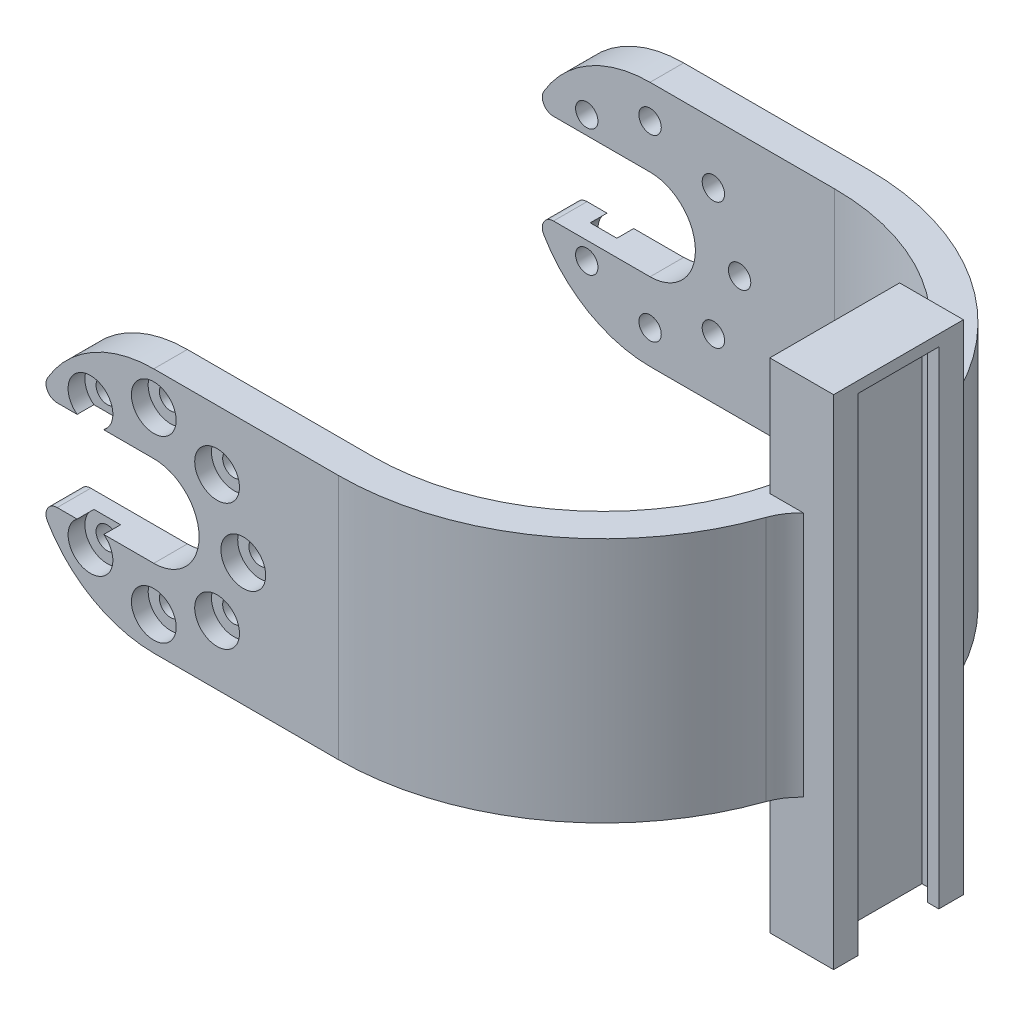
from build123d import *

# Parameters (mm, degrees)
SKETCH1_W                 = 120
SKETCH1_H                 = 22
EXTRUDE_THIN1_DEPTH       = 3
SKETCH2_R                 = 4.05
CUT_EXTRUDE1_DEPTH        = 123.036879672
FILLET2_R                 = 11
SKETCH5_R                 = 1
CUT_EXTRUDE3_DEPTH        = 123.036879672
CIRPATTERN1_COUNT         = 8
SKETCH10_R                = 2
CUT_EXTRUDE5_DEPTH        = 1.5
CIRPATTERN3_COUNT         = 8
SKETCH11_R                = 4.05
SKETCH11_R_2              = 1
BOSS_EXTRUDE1_DEPTH       = 3
CUT_EXTRUDE6_START        = -1.5
SKETCH12_R                = 2
CUT_EXTRUDE6_DEPTH        = 1.5
CIRPATTERN4_COUNT         = 8
SKETCH13_W                = 5
SKETCH13_H                = 22
BOSS_EXTRUDE2_DEPTH       = 41.35
CUT_EXTRUDE7_START        = -1
CUT_EXTRUDE7_DEPTH        = 12
FILLET4_R                 = 1
SKETCH20_W                = 10
SKETCH20_H                = 36
BOSS_EXTRUDE3_DEPTH       = 2
BOSS_EXTRUDE4_DEPTH       = 3
SKETCH24_W                = 10
SKETCH24_H                = 5.5
BOSS_EXTRUDE5_DEPTH       = 3
SKETCH25_W                = 10
SKETCH25_H                = 5.5
BOSS_EXTRUDE6_DEPTH       = 2.85
SKETCH22_R                = 1.35
CUT_EXTRUDE9_DEPTH        = 132.178971257
FILLET6_R                 = 2
FILLET7_R                 = 10
SKETCH29_W                = 10
SKETCH29_H                = 1.7
BOSS_EXTRUDE7_DEPTH       = 3
SKETCH30_W                = 10
SKETCH30_H                = 1.7
BOSS_EXTRUDE8_DEPTH       = 3
FILLET8_R                 = 3
FILLET9_R                 = 3
CUT_EXTRUDE10_REACH       = 134.223
SKETCH31_R                = 1.143
CUT_EXTRUDE11_DEPTH       = 10
CUT_EXTRUDE11_DEPTH_BACK  = 30
SKETCH32_W                = 86.5
SKETCH32_H                = 47.35
SKETCH38_W                = 6
SKETCH38_H                = 47.35
CUT_EXTRUDE19_DEPTH       = 35
BOSS_EXTRUDE11_DEPTH      = 22
BOSS_EXTRUDE12_DEPTH      = 21.5
BOSS_EXTRUDE12_DEPTH_BACK = 43.5
SKETCH39_W                = 3
SKETCH39_H                = 11.6
FILLET10_R                = 5
SKETCH40_W                = 1
SKETCH40_H                = 65
BOSS_EXTRUDE13_DEPTH      = 1.7
SKETCH42_W                = 2.2
SKETCH42_H                = 65
BOSS_EXTRUDE14_DEPTH      = 1
SKETCH43_W                = 1.7
SKETCH43_H                = 9.6
BOSS_EXTRUDE15_DEPTH      = 1.15
SKETCH44_W                = 1
SKETCH44_H                = 7.2
BOSS_EXTRUDE16_DEPTH      = 2.09
SKETCH46_W                = 11.6
SKETCH46_H                = 11
SKETCH46_H_2              = 9.5
CUT_EXTRUDE20_DEPTH       = 10
BOSS_EXTRUDE17_REACH      = 78.68
SKETCH48_W                = 11.6
SKETCH48_H                = 1


with BuildPart() as part:
    # Sketch1 → Extrude-Thin1 (new body)
    with BuildSketch(Plane.XY):
        with Locations((60, -11)):
            Rectangle(SKETCH1_W, SKETCH1_H)
    extrude(amount=EXTRUDE_THIN1_DEPTH)

    # Sketch2 → Cut-Extrude1 (cut, through all)
    with BuildSketch(Plane.XY.offset(3)):
        with Locations((11, -11)):
            Circle(SKETCH2_R)
    extrude(amount=-CUT_EXTRUDE1_DEPTH, mode=Mode.SUBTRACT)

    # Fillet2
    fillet2_edges = [part.edges().sort_by_distance(p)[0] for p in [
        (0, -22, 1.5),
        (0, 0, 1.5),
    ]]
    fillet(fillet2_edges, radius=FILLET2_R - 0.0001)  # a hair under: the kernel refuses the full size

    # Sketch5 → Cut-Extrude3 (cut, through all)
    with BuildSketch(Plane.XY.offset(3)):
        with Locations((11, -3)):
            Circle(SKETCH5_R)
    cut_extrude3 = extrude(amount=-CUT_EXTRUDE3_DEPTH, mode=Mode.SUBTRACT)

    # CirPattern1: Cut-Extrude3 ×8 about axis
    cirpattern1_axis = Axis((11, -11, 0), (0, 0, 1))
    for i in range(1, CIRPATTERN1_COUNT):
        add(cut_extrude3.rotate(cirpattern1_axis, i * 360 / CIRPATTERN1_COUNT), mode=Mode.SUBTRACT)

    # Sketch10 → Cut-Extrude5 (cut)
    with BuildSketch(Plane.XY.offset(3)):
        with Locations((11, -3)):
            Circle(SKETCH10_R)
    cut_extrude5 = extrude(amount=-CUT_EXTRUDE5_DEPTH, mode=Mode.SUBTRACT)

    # CirPattern3: Cut-Extrude5 ×8 about axis
    cirpattern3_axis = Axis((11, -11, 0), (0, 0, 1))
    for i in range(1, CIRPATTERN3_COUNT):
        add(cut_extrude5.rotate(cirpattern3_axis, i * 360 / CIRPATTERN3_COUNT), mode=Mode.SUBTRACT)



with BuildPart() as body_2:
    # Sketch11 → Boss-Extrude1 (new body)
    with BuildSketch(Plane.XY.offset(-41.35)):
        with BuildLine():
            Line((11, 0), (120, 0))
            Line((120, 0), (120, -22))
            Line((120, -22), (11, -22))
            ThreePointArc((11, -22), (3.221825407, -18.778174593), (0, -11))
            ThreePointArc((0, -11), (3.221825407, -3.221825407), (11, 0))
        make_face()
        with Locations((11, -11)):
            Circle(SKETCH11_R, mode=Mode.SUBTRACT)
        with Locations((11, -3)):
            Circle(SKETCH11_R_2, mode=Mode.SUBTRACT)
        with Locations(Location((5.343145751, -5.343145751, 0), (0, 0, 45))):
            Circle(SKETCH11_R_2, mode=Mode.SUBTRACT)
        with Locations(Location((3, -11, 0), (0, 0, 90))):
            Circle(SKETCH11_R_2, mode=Mode.SUBTRACT)
        with Locations(Location((5.343145751, -16.656854249, 0), (0, 0, 135))):
            Circle(SKETCH11_R_2, mode=Mode.SUBTRACT)
        with Locations(Location((11, -19, 0), (0, 0, 180))):
            Circle(SKETCH11_R_2, mode=Mode.SUBTRACT)
        with Locations(Location((16.656854249, -16.656854249, 0), (0, 0, 225))):
            Circle(SKETCH11_R_2, mode=Mode.SUBTRACT)
        with Locations(Location((16.656854249, -5.343145751, 0), (0, 0, 315))):
            Circle(SKETCH11_R_2, mode=Mode.SUBTRACT)
        with Locations(Location((19, -11, 0), (0, 0, 270))):
            Circle(SKETCH11_R_2, mode=Mode.SUBTRACT)
    extrude(amount=-BOSS_EXTRUDE1_DEPTH)

    # Sketch12 → Cut-Extrude6 (cut)
    with BuildSketch(Plane(origin=(0, 0, -44.35), x_dir=(-1, 0, 0), z_dir=(0, 0, -1)).offset(CUT_EXTRUDE6_START)):
        with Locations(Location((-11, -3, 0), (0, 0, 180))):
            Circle(SKETCH12_R)
    cut_extrude6 = extrude(amount=CUT_EXTRUDE6_DEPTH, mode=Mode.SUBTRACT)

    # CirPattern4: Cut-Extrude6 ×8 about axis
    cirpattern4_axis = Axis((11, -11, 0), (0, 0, 1))
    for i in range(1, CIRPATTERN4_COUNT):
        add(cut_extrude6.rotate(cirpattern4_axis, i * 360 / CIRPATTERN4_COUNT), mode=Mode.SUBTRACT)


with BuildPart() as part_1:
    add(part.part)

    add(body_2.part)  # Boss-Extrude2 merges body 2
    # Sketch13 → Boss-Extrude2 (add)
    with BuildSketch(Plane(origin=(0, 0, 0), x_dir=(-1, 0, 0), z_dir=(0, 0, -1))):
        with Locations((-62.5, -11)):
            Rectangle(SKETCH13_W, SKETCH13_H)
    extrude(amount=BOSS_EXTRUDE2_DEPTH)

    # Cut-Extrude7: read off the stored shape, not the designer's step
    # Cut-Extrude7 outline → Cut-Extrude7 (cut)
    with BuildSketch(Plane.YZ.offset(CUT_EXTRUDE7_START)):
        Polygon((-6.95, -41.35), (-15.05, -41.35), (-15.05, -42.85), (-15.05, -44.35), (-6.95, -44.35), (-6.95, -42.85), align=None)
        Polygon((-6.95, 3), (-15.05, 3), (-15.05, 1.5), (-15.05, 0), (-6.95, 0), (-6.95, 1.5), align=None)
    extrude(amount=CUT_EXTRUDE7_DEPTH, mode=Mode.SUBTRACT)

    # Fillet4
    fillet4_edges = [part_1.edges().sort_by_distance(p)[0] for p in [
        (0.772676036, -15.05, 1.5),
        (0.772676036, -6.95, 1.5),
        (0.772708081, -6.95, -42.85),
        (0.772708081, -15.05, -42.85),
    ]]
    fillet(fillet4_edges, radius=FILLET4_R)

    # Sketch20 → Boss-Extrude3 (add)
    with BuildSketch(Plane.XY.offset(-41.35)):
        with Locations((115, -11)):
            Rectangle(SKETCH20_W, SKETCH20_H)
    extrude(amount=BOSS_EXTRUDE3_DEPTH)

    # Sketch21 → Boss-Extrude4 (add)
    with BuildSketch(Plane(origin=(0, 0, 0), x_dir=(-1, 0, 0), z_dir=(0, 0, -1))):
        Polygon((-120, -22), (-120, 0), (-120, 7), (-110, 7), (-110, 0), (-110, -22), (-110, -29), (-120, -29), align=None)
    extrude(amount=BOSS_EXTRUDE4_DEPTH)

    # Sketch24 → Boss-Extrude5 (add)
    with BuildSketch(Plane(origin=(0, 0, -3), x_dir=(-1, 0, 0), z_dir=(0, 0, -1))):
        with Locations((-115, 4.25)):
            Rectangle(SKETCH24_W, SKETCH24_H)
        with Locations((-115, -26.25)):
            Rectangle(SKETCH24_W, SKETCH24_H)
    extrude(amount=BOSS_EXTRUDE5_DEPTH)

    # Sketch25 → Boss-Extrude6 (add)
    with BuildSketch(Plane.XY.offset(-39.35)):
        with Locations((115, 4.25)):
            Rectangle(SKETCH25_W, SKETCH25_H)
        with Locations((115, -26.25)):
            Rectangle(SKETCH25_W, SKETCH25_H)
    extrude(amount=BOSS_EXTRUDE6_DEPTH)

    # Sketch22 → Cut-Extrude9 (cut, through all)
    with BuildSketch(Plane(origin=(0, 0, -41.35), x_dir=(-1, 0, 0), z_dir=(0, 0, -1))):
        with Locations((-114.967399898, 4)):
            Circle(SKETCH22_R)
        with Locations((-114.967399898, -26)):
            Circle(SKETCH22_R)
    extrude(amount=-CUT_EXTRUDE9_DEPTH, mode=Mode.SUBTRACT)

    # Fillet6
    fillet6_edges = [part_1.edges().sort_by_distance(p)[0] for p in [
        (110, 7, -38.925),
        (110, -29, -38.925),
        (120, -29, -38.925),
        (120, 7, -38.925),
        (120, -29, -3),
        (110, -29, -3),
        (110, 7, -3),
        (120, 7, -3),
    ]]
    fillet(fillet6_edges, radius=FILLET6_R)

    # Fillet7
    # the kernel refuses this fillet: 10 mm, written as the material it adds along each edge
    with BuildSketch(Plane(origin=(110, -22, 0), x_dir=(-1, 0, 0), z_dir=(0, 1, 0))) as fillet7_piece_1:
        with BuildLine():
            CenterArc((7.141428429, -10), FILLET7_R, 90, 45.572995999)
            Line((0, -3), (0, 0))
            Line((0, 0), (7.141428429, 0))
        make_face()
    extrude(amount=22)
    with BuildSketch(Plane(origin=(110, -22, -41.35), x_dir=(0, 0, 1), z_dir=(0, 1, 0))) as fillet7_piece_2:
        with BuildLine():
            CenterArc((10, -6), FILLET7_R, 143.130102354, 36.869897646)
            Line((0, -6), (0, 0))
            Line((0, 0), (2, 0))
        make_face()
    extrude(amount=22)

    # Sketch29 → Boss-Extrude7 (add)
    with BuildSketch(Plane(origin=(0, 0, -41.35), x_dir=(-1, 0, 0), z_dir=(0, 0, -1))):
        with Locations((-115, 0.85)):
            Rectangle(SKETCH29_W, SKETCH29_H)
        with Locations((-115, -22.85)):
            Rectangle(SKETCH29_W, SKETCH29_H)
    extrude(amount=BOSS_EXTRUDE7_DEPTH)

    # Sketch30 → Boss-Extrude8 (add)
    with BuildSketch(Plane.XY):
        with Locations((115, 0.85)):
            Rectangle(SKETCH30_W, SKETCH30_H)
        with Locations((115, -22.85)):
            Rectangle(SKETCH30_W, SKETCH30_H)
    extrude(amount=BOSS_EXTRUDE8_DEPTH)

    # Fillet8
    # the kernel refuses this fillet: 3 mm, written as the material it adds along each edge
    with BuildSketch(Plane(origin=(110, 0, 3), x_dir=(-1, 0, 0), z_dir=(0, 0, -1))) as fillet8_piece_1_section:
        with BuildLine():
            CenterArc((FILLET8_R, FILLET8_R), FILLET8_R, 180, 90)
            Line((0, FILLET8_R), (0, 0))
            Line((0, 0), (FILLET8_R, 0))
        make_face()
    fillet8_piece_1 = extrude(amount=13.5, mode=Mode.PRIVATE)
    fillet8_piece_1 = split(fillet8_piece_1, bisect_by=Plane(origin=(110, 1.7, 3), z_dir=(0, -1, 0)), keep=Keep.TOP, mode=Mode.PRIVATE)
    fillet8_piece_1 = fillet8_piece_1 - Plane(origin=(102.858571571, 0, -10), x_dir=(-1, 0, 0), z_dir=(0, -1, 0)) * Cylinder(10, 39, mode=Mode.PRIVATE)
    add(fillet8_piece_1)
    with BuildSketch(Plane(origin=(110, 0, 10.5), x_dir=(-1, 0, 0), z_dir=(0, 0, -1))) as fillet8_piece_2_section:
        with BuildLine():
            CenterArc((FILLET8_R, FILLET8_R), FILLET8_R, 180, 90)
            Line((0, FILLET8_R), (0, 0))
            Line((0, 0), (FILLET8_R, 0))
        make_face()
    fillet8_piece_2 = extrude(amount=21, mode=Mode.PRIVATE)
    fillet8_piece_2 = split(fillet8_piece_2, bisect_by=Plane(origin=(110, 1.5, 10.5), z_dir=(0, 1, 0)), keep=Keep.TOP, mode=Mode.PRIVATE)
    fillet8_piece_2 = split(fillet8_piece_2, bisect_by=Plane(origin=(110, 0, -6), z_dir=(0, 0, 1)), keep=Keep.TOP, mode=Mode.PRIVATE)
    fillet8_piece_2 = split(fillet8_piece_2, bisect_by=Plane(origin=(110, 0, 0), z_dir=(0, 0, -1)), keep=Keep.TOP, mode=Mode.PRIVATE)
    add(fillet8_piece_2)

    # Fillet9
    # the kernel refuses this fillet: 3 mm, written as the material it adds along each edge
    with BuildSketch(Plane(origin=(110, -22, -10.5), x_dir=(-1, 0, 0), z_dir=(0, 0, 1))) as fillet9_piece_1_section:
        with BuildLine():
            CenterArc((FILLET9_R, FILLET9_R), FILLET9_R, 180, 90)
            Line((0, FILLET9_R), (0, 0))
            Line((0, 0), (FILLET9_R, 0))
        make_face()
    fillet9_piece_1 = extrude(amount=21, mode=Mode.PRIVATE)
    fillet9_piece_1 = split(fillet9_piece_1, bisect_by=Plane(origin=(110, -22, 0), z_dir=(0, 0, -1)), keep=Keep.TOP, mode=Mode.PRIVATE)
    fillet9_piece_1 = split(fillet9_piece_1, bisect_by=Plane(origin=(110, -22, -6), z_dir=(0, 0, 1)), keep=Keep.TOP, mode=Mode.PRIVATE)
    fillet9_piece_1 = split(fillet9_piece_1, bisect_by=Plane(origin=(110, -23.5, -10.5), z_dir=(0, -1, 0)), keep=Keep.TOP, mode=Mode.PRIVATE)
    add(fillet9_piece_1)
    with BuildSketch(Plane(origin=(110, -22, -10.5), x_dir=(-1, 0, 0), z_dir=(0, 0, 1))) as fillet9_piece_2_section:
        with BuildLine():
            CenterArc((FILLET9_R, FILLET9_R), FILLET9_R, 180, 90)
            Line((0, FILLET9_R), (0, 0))
            Line((0, 0), (FILLET9_R, 0))
        make_face()
    fillet9_piece_2 = extrude(amount=13.5, mode=Mode.PRIVATE)
    fillet9_piece_2 = split(fillet9_piece_2, bisect_by=Plane(origin=(110, -23.7, -10.5), z_dir=(0, 1, 0)), keep=Keep.TOP, mode=Mode.PRIVATE)
    fillet9_piece_2 = fillet9_piece_2 - Plane(origin=(102.858571571, -22, -10), x_dir=(-1, 0, 0), z_dir=(0, -1, 0)) * Cylinder(10, 39, mode=Mode.PRIVATE)
    add(fillet9_piece_2)
    with BuildSketch(Plane(origin=(110, 0, -31.85), x_dir=(-1, 0, 0), z_dir=(0, 0, -1))) as fillet9_piece_3_section:
        with BuildLine():
            CenterArc((FILLET9_R, FILLET9_R), FILLET9_R, 180, 90)
            Line((0, FILLET9_R), (0, 0))
            Line((0, 0), (FILLET9_R, 0))
        make_face()
    fillet9_piece_3 = extrude(amount=20, mode=Mode.PRIVATE)
    fillet9_piece_3 = split(fillet9_piece_3, bisect_by=Plane(origin=(110, 0, -41.35), z_dir=(0, 0, 1)), keep=Keep.TOP, mode=Mode.PRIVATE)
    fillet9_piece_3 = split(fillet9_piece_3, bisect_by=Plane(origin=(110, 0, -36.5), z_dir=(0, 0, -1)), keep=Keep.TOP, mode=Mode.PRIVATE)
    fillet9_piece_3 = split(fillet9_piece_3, bisect_by=Plane(origin=(110, 1.5, -31.85), z_dir=(0, 1, 0)), keep=Keep.TOP, mode=Mode.PRIVATE)
    add(fillet9_piece_3)
    with BuildSketch(Plane(origin=(110, 0, -31.85), x_dir=(-1, 0, 0), z_dir=(0, 0, -1))) as fillet9_piece_4_section:
        with BuildLine():
            CenterArc((FILLET9_R, FILLET9_R), FILLET9_R, 180, 90)
            Line((0, FILLET9_R), (0, 0))
            Line((0, 0), (FILLET9_R, 0))
        make_face()
    fillet9_piece_4 = extrude(amount=12.5, mode=Mode.PRIVATE)
    fillet9_piece_4 = fillet9_piece_4 - Plane(origin=(104, 0, -31.35), x_dir=(0, 0, 1), z_dir=(0, -1, 0)) * Cylinder(10, 38, mode=Mode.PRIVATE)
    fillet9_piece_4 = split(fillet9_piece_4, bisect_by=Plane(origin=(110, 1.7, -31.85), z_dir=(0, -1, 0)), keep=Keep.TOP, mode=Mode.PRIVATE)
    add(fillet9_piece_4)
    with BuildSketch(Plane(origin=(110, -22, -44.35), x_dir=(-1, 0, 0), z_dir=(0, 0, 1))) as fillet9_piece_5_section:
        with BuildLine():
            CenterArc((FILLET9_R, FILLET9_R), FILLET9_R, 180, 90)
            Line((0, FILLET9_R), (0, 0))
            Line((0, 0), (FILLET9_R, 0))
        make_face()
    fillet9_piece_5 = extrude(amount=12.5, mode=Mode.PRIVATE)
    fillet9_piece_5 = fillet9_piece_5 - Plane(origin=(104, -22, -31.35), x_dir=(0, 0, 1), z_dir=(0, -1, 0)) * Cylinder(10, 38, mode=Mode.PRIVATE)
    fillet9_piece_5 = split(fillet9_piece_5, bisect_by=Plane(origin=(110, -23.7, -44.35), z_dir=(0, 1, 0)), keep=Keep.TOP, mode=Mode.PRIVATE)
    add(fillet9_piece_5)
    with BuildSketch(Plane(origin=(110, -22, -51.85), x_dir=(-1, 0, 0), z_dir=(0, 0, 1))) as fillet9_piece_6_section:
        with BuildLine():
            CenterArc((FILLET9_R, FILLET9_R), FILLET9_R, 180, 90)
            Line((0, FILLET9_R), (0, 0))
            Line((0, 0), (FILLET9_R, 0))
        make_face()
    fillet9_piece_6 = extrude(amount=20, mode=Mode.PRIVATE)
    fillet9_piece_6 = split(fillet9_piece_6, bisect_by=Plane(origin=(110, -22, -41.35), z_dir=(0, 0, 1)), keep=Keep.TOP, mode=Mode.PRIVATE)
    fillet9_piece_6 = split(fillet9_piece_6, bisect_by=Plane(origin=(110, -23.5, -51.85), z_dir=(0, -1, 0)), keep=Keep.TOP, mode=Mode.PRIVATE)
    fillet9_piece_6 = split(fillet9_piece_6, bisect_by=Plane(origin=(110, -22, -36.5), z_dir=(0, 0, -1)), keep=Keep.TOP, mode=Mode.PRIVATE)
    add(fillet9_piece_6)

    # Sketch31 → Cut-Extrude10 (cut, up to next)
    with BuildSketch(Plane(origin=(0, 0, -44.35), x_dir=(-1, 0, 0), z_dir=(0, 0, -1)), mode=Mode.PRIVATE) as cut_extrude10_sk1:
        with Locations((-91.23, -11)):
            Circle(SKETCH31_R)
    cut_extrude10_tool1 = extrude(cut_extrude10_sk1.sketch, amount=-CUT_EXTRUDE10_REACH, mode=Mode.PRIVATE) & part_1.part
    # Sketch31 → Cut-Extrude10 (cut, up to next)
    with BuildSketch(Plane(origin=(0, 0, -44.35), x_dir=(-1, 0, 0), z_dir=(0, 0, -1)), mode=Mode.PRIVATE) as cut_extrude10_sk2:
        with Locations((-77.768, -11)):
            Circle(SKETCH31_R)
    cut_extrude10_tool2 = extrude(cut_extrude10_sk2.sketch, amount=-CUT_EXTRUDE10_REACH, mode=Mode.PRIVATE) & part_1.part
    add(cut_extrude10_tool1.solids().sort_by_distance((91.23, -11, -44.35))[0], mode=Mode.SUBTRACT)
    add(cut_extrude10_tool1.solids().sort_by_distance((91.23, -11, -44.35))[1], mode=Mode.SUBTRACT)
    add(cut_extrude10_tool2.solids().sort_by_distance((77.768, -11, -44.35))[0], mode=Mode.SUBTRACT)
    add(cut_extrude10_tool2.solids().sort_by_distance((77.768, -11, -44.35))[1], mode=Mode.SUBTRACT)

    # Sketch32 → Cut-Extrude11 (cut, two sides: drawn at the far end of the back side and taken through both)
    with BuildSketch(Plane.XZ.offset(22).offset(-CUT_EXTRUDE11_DEPTH_BACK)):
        with Locations((76.75, -20.675)):
            Rectangle(SKETCH32_W, SKETCH32_H)
    extrude(amount=CUT_EXTRUDE11_DEPTH + CUT_EXTRUDE11_DEPTH_BACK, mode=Mode.SUBTRACT)


with BuildPart() as cut_extrude11_piece_1:
    # of the separate pieces the step leaves, piece 1, a body of its own (cut_extrude11_pieces)
    add(part_1.part.solids().sort_by_distance((33.5, -22, 0))[0])


with BuildPart() as cut_extrude11_piece_2:
    # of the separate pieces the step leaves, piece 2, a body of its own (cut_extrude11_pieces)
    add(part_1.part.solids().sort_by_distance((33.5, -22, -44.35))[0])


with BuildPart() as cut_extrude19_tool:
    # Sketch38 → Cut-Extrude19 (new body)
    with BuildSketch(Plane(origin=(0, 0, 0), x_dir=(1, 0, 0), z_dir=(0, 1, 0))):
        with Locations((30.5, 20.675)):
            Rectangle(SKETCH38_W, SKETCH38_H)
    extrude(amount=-CUT_EXTRUDE19_DEPTH)


with BuildPart() as cut_extrude11_piece_1_1:
    add(cut_extrude11_piece_1.part)

    # Cut-Extrude19: cut by cut_extrude19_tool
    add(cut_extrude19_tool.part, mode=Mode.SUBTRACT)



with BuildPart() as cut_extrude11_piece_2_1:
    add(cut_extrude11_piece_2.part)

    # Cut-Extrude19: cut by cut_extrude19_tool
    add(cut_extrude19_tool.part, mode=Mode.SUBTRACT)


with BuildPart() as cut_extrude11_piece_1_2:
    add(cut_extrude11_piece_1_1.part)

    add(cut_extrude11_piece_2_1.part)  # Boss-Extrude11 merges Cut-Extrude11 piece 2
    # Sketch35 → Boss-Extrude11 (add)
    with BuildSketch(Plane.XZ.offset(22)):
        with BuildLine():
            Line((33.5, 0), (27.5, 0))
            ThreePointArc((27.5, 0), (48.175, -20.675), (27.5, -41.35))
            Line((27.5, -41.35), (33.5, -41.35))
            Line((33.5, -41.35), (33.5, -43.577087787))
            ThreePointArc((33.5, -43.577087787), (51.175, -20.675), (33.5, 2.227087787))
            Line((33.5, 2.227087787), (33.5, 0))
        make_face()
        with BuildLine():
            Line((33.5, -41.35), (27.5, -41.35))
            Line((27.5, -41.35), (27.5, -44.35))
            ThreePointArc((27.5, -44.35), (30.524788972, -44.155976911), (33.5, -43.577087787))
            Line((33.5, -43.577087787), (33.5, -41.35))
        make_face()
        with BuildLine():
            ThreePointArc((33.5, 2.227087787), (30.524788972, 2.805976911), (27.5, 3))
            Line((27.5, 3), (27.5, 0))
            Line((27.5, 0), (33.5, 0))
            Line((33.5, 0), (33.5, 2.227087787))
        make_face()
    extrude(amount=-BOSS_EXTRUDE11_DEPTH)

    # Sketch39 → Boss-Extrude12 (add, two sides: drawn at the far end of the back side and taken through both)
    with BuildSketch(Plane.XZ.offset(22).offset(-BOSS_EXTRUDE12_DEPTH_BACK)):
        with Locations((49.675, -20.675)):
            Rectangle(SKETCH39_W, SKETCH39_H)
    extrude(amount=BOSS_EXTRUDE12_DEPTH + BOSS_EXTRUDE12_DEPTH_BACK)

    # Fillet10
    # the kernel refuses this fillet: 5 mm, written as the material it adds along each edge
    with BuildSketch(Plane(origin=(50.453553646, 0, -26.475), x_dir=(1, 0, 0), z_dir=(0, -1, 0))) as fillet10_piece_1:
        with BuildLine():
            CenterArc((4.110352594, -3.676318062), FILLET10_R, 132.670504294, 28.031998399)
            Line((-0.608724344, -2.023952227), (-0.703105883, -1.990904911))
            ThreePointArc((-0.703105883, -1.990904911), (-0.377528237, -0.989970671), (-0.096952708, 0.024498416))
            Line((-0.096952708, 0.024498416), (0, 0.1))
            ThreePointArc((0, 0.1), (0.360723177, 0.1), (0.653668229, 0.073526361))
            Line((0.653668229, 0.073526361), (0.721446354, 0))
        make_face()
    extrude(amount=22)
    with BuildSketch(Plane(origin=(50.453553646, 0, -14.875), x_dir=(1, 0, 0), z_dir=(0, -1, 0))) as fillet10_piece_2:
        with BuildLine():
            CenterArc((4.110352594, 3.676318062), FILLET10_R, 199.297497307, 28.031998399)
            Line((-0.608724344, 2.023952227), (-0.703105883, 1.990904911))
            ThreePointArc((-0.703105883, 1.990904911), (-0.377528237, 0.989970671), (-0.096952708, -0.024498416))
            Line((-0.096952708, -0.024498416), (0, -0.1))
            ThreePointArc((0, -0.1), (0.360723177, -0.1), (0.653668229, -0.073526361))
            Line((0.653668229, -0.073526361), (0.721446354, 0))
        make_face()
    extrude(amount=22)

    # Sketch40 → Boss-Extrude13 (add)
    with BuildSketch(Plane(origin=(51.175, 0, 0), x_dir=(0, 0, -1), z_dir=(1, 0, 0))):
        with Locations((15.375, -11)):
            Rectangle(SKETCH40_W, SKETCH40_H)
        with Locations((25.975, -11)):
            Rectangle(SKETCH40_W, SKETCH40_H)
    extrude(amount=BOSS_EXTRUDE13_DEPTH)

    # Sketch42 → Boss-Extrude14 (add)
    with BuildSketch(Plane(origin=(52.875, 0, 0), x_dir=(0, 0, -1), z_dir=(1, 0, 0))):
        with Locations((15.975, -11)):
            Rectangle(SKETCH42_W, SKETCH42_H)
        with Locations((25.375, -11)):
            Rectangle(SKETCH42_W, SKETCH42_H)
    extrude(amount=BOSS_EXTRUDE14_DEPTH)

    # Sketch43 → Boss-Extrude15 (add)
    with BuildSketch(Plane(origin=(0, 21.5, 0), x_dir=(1, 0, 0), z_dir=(0, 1, 0))):
        with Locations((52.025, 20.675)):
            Rectangle(SKETCH43_W, SKETCH43_H)
    extrude(amount=-BOSS_EXTRUDE15_DEPTH)

    # Sketch44 → Boss-Extrude16 (add)
    with BuildSketch(Plane(origin=(0, 21.5, 0), x_dir=(1, 0, 0), z_dir=(0, 1, 0))):
        with Locations((53.375, 20.675)):
            Rectangle(SKETCH44_W, SKETCH44_H)
    extrude(amount=-BOSS_EXTRUDE16_DEPTH)

    # Sketch46 → Cut-Extrude20 (cut)
    with BuildSketch(Plane.ZY.offset(-48.175)):
        with Locations((-20.675, 16)):
            Rectangle(SKETCH46_W, SKETCH46_H)
        with Locations((-20.675, -38.75)):
            Rectangle(SKETCH46_W, SKETCH46_H_2)
    extrude(amount=-CUT_EXTRUDE20_DEPTH, mode=Mode.SUBTRACT)

    # Boss-Extrude17: up to this face of the body (flat: up to its plane)
    boss_extrude17_end = Plane(cut_extrude11_piece_1_2.part.faces().sort_by_distance((51.175, -11.75, -25.019762699))[0])
    # Sketch48 → Boss-Extrude17 (add, up to the picked face)
    with BuildSketch(Plane(origin=(53.875, 0, 0), x_dir=(0, 0, -1), z_dir=(1, 0, 0)), mode=Mode.PRIVATE) as boss_extrude17_sk1:
        with Locations((20.675, 10)):
            Rectangle(SKETCH48_W, SKETCH48_H)
    boss_extrude17_tool1 = split(extrude(boss_extrude17_sk1.sketch, amount=-BOSS_EXTRUDE17_REACH, mode=Mode.PRIVATE), bisect_by=boss_extrude17_end, keep=Keep.BOTH, mode=Mode.PRIVATE)
    add(boss_extrude17_tool1.solids().sort_by(Axis((53.875, 10, -20.675), (-1, 0, 0)))[0])


solid = cut_extrude11_piece_1_2.part
